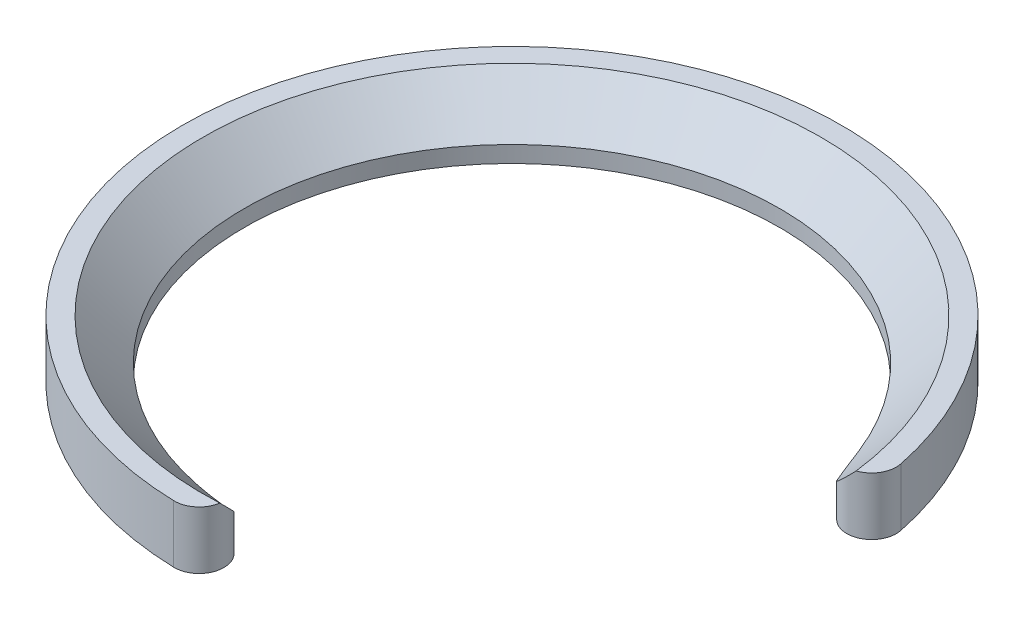
from build123d import *

# Parameters (mm, degrees)
REVOLVE1_ANGLE = 280
FILLET1_DEPTH  = 4
FILLET2_R      = 1.2


with BuildPart() as part:
    # Sketch1 → Revolve1 (revolve)
    with BuildSketch(Plane.XY):
        Polygon((13, 0), (13, 0.8), (15, 2.8), (16, 2.8), (16, 0), align=None)
    revolve(axis=Axis((0, 0, 0), (0, 1, 0)), revolution_arc=REVOLVE1_ANGLE)

    # Fillet1: read off the stored shape, not the designer's step
    # Fillet1 outline → Fillet1 (cut)
    with BuildSketch(Plane(origin=(0, 0, 0), x_dir=(1, 0, 0), z_dir=(0, 1, 0))):
        with BuildLine():
            Line((13, 0), (16, 0))
            ThreePointArc((16, 0), (13.674960129, 2.07014875), (12.099184783, 4.754968727))
            ThreePointArc((12.099184783, 4.754968727), (12.77281101, 2.419772492), (13, 0))
        make_face()
        with BuildLine():
            ThreePointArc((2.25742631, -12.802500789), (-0.165035355, -12.998952394), (-2.581728679, -12.741062633))
            ThreePointArc((-2.581728679, -12.741062633), (0.335933367, -13.826684315), (2.778370843, -15.756924048))
            Line((2.778370843, -15.756924048), (2.25742631, -12.802500789))
        make_face()
    extrude(amount=FILLET1_DEPTH, mode=Mode.SUBTRACT)

    # Fillet2
    fillet2_edges = [part.edges().sort_by_distance(p)[0] for p in [
        (16, 1.4, 0),
        (2.778370843, 1.4, 15.756924048),
    ]]
    fillet(fillet2_edges, radius=FILLET2_R)


solid = part.part
